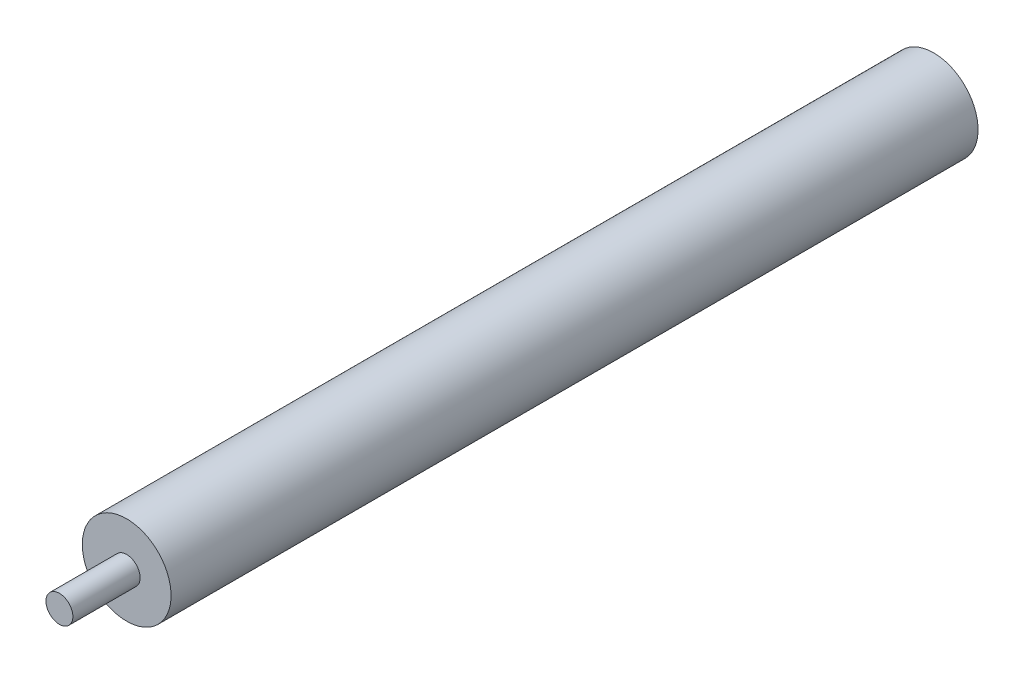
from build123d import *

# Parameters (mm, degrees)
SKETCH1_R           = 9.9
BOSS_EXTRUDE1_DEPTH = 180
SKETCH2_R           = 3
BOSS_EXTRUDE2_DEPTH = 15


with BuildPart() as part:
    # Sketch1 → Boss-Extrude1 (new body)
    with BuildSketch(Plane.XY):
        Circle(SKETCH1_R)
    extrude(amount=BOSS_EXTRUDE1_DEPTH)

    # Sketch2 → Boss-Extrude2 (add)
    with BuildSketch(Plane.XY.offset(180)):
        Circle(SKETCH2_R)
    extrude(amount=BOSS_EXTRUDE2_DEPTH)


solid = part.part
